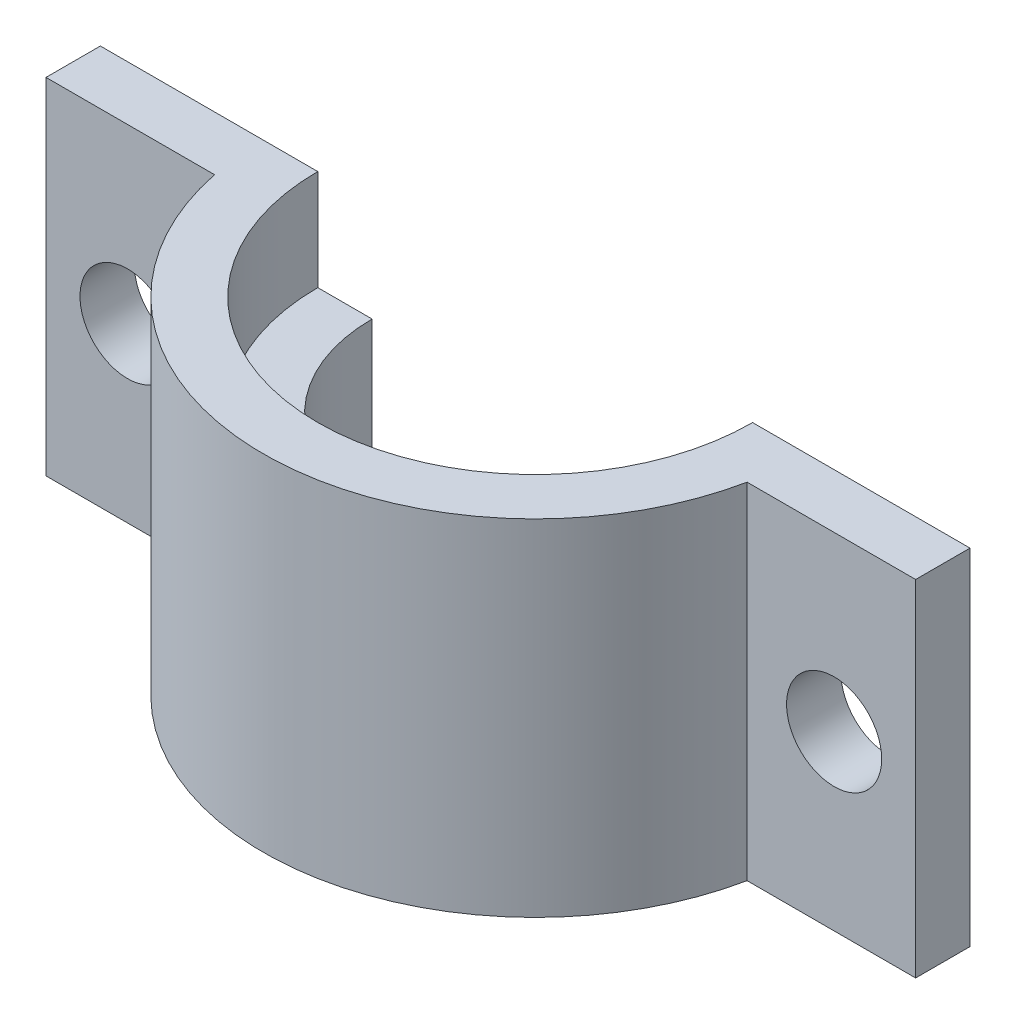
from build123d import *

# Parameters (mm, degrees)
SKETCH1_W           = 32
SKETCH1_H           = 12.7
BOSS_EXTRUDE1_DEPTH = 12
CUT_EXTRUDE1_DEPTH  = 24.691559679
SKETCH5_R           = 1.75
CUT_EXTRUDE2_DEPTH  = 19.98216268


with BuildPart() as part:
    # Sketch1 → Boss-Extrude1 (new body)
    with BuildSketch(Plane.XY):
        Rectangle(SKETCH1_W, SKETCH1_H)
    extrude(amount=BOSS_EXTRUDE1_DEPTH)

    # Sketch3 → Cut-Revolve1 (revolve, cut)
    with BuildSketch(Plane(origin=(0, 0, 0), x_dir=(0, 0, -1), z_dir=(1, 0, 0))):
        Polygon((0, 6.35), (-8, 6.35), (-8, 2.65), (-6, 2.65), (-6, -3.35), (-8, -3.35), (-8, -6.35), (0, -6.35), align=None)
    revolve(axis=Axis((0, 6.35, 0), (0, -1, 0)), mode=Mode.SUBTRACT)

    # Sketch4 → Cut-Extrude1 (cut, through all)
    with BuildSketch(Plane(origin=(0, 6.35, 0), x_dir=(1, 0, 0), z_dir=(0, 1, 0))):
        with BuildLine():
            Line((-16, -2), (-9.797958971, -2))
            ThreePointArc((-9.797958971, -2), (0, -10), (9.797958971, -2))
            Line((9.797958971, -2), (16, -2))
            Line((16, -2), (16, -15))
            Line((16, -15), (-16, -15))
            Line((-16, -15), (-16, -2))
        make_face()
    extrude(amount=-CUT_EXTRUDE1_DEPTH, mode=Mode.SUBTRACT)

    # Sketch5 → Cut-Extrude2 (cut, through all)
    with BuildSketch(Plane.XY.offset(2)):
        with Locations((-13, 0)):
            Circle(SKETCH5_R)
        with Locations((13, 0)):
            Circle(SKETCH5_R)
    extrude(amount=-CUT_EXTRUDE2_DEPTH, mode=Mode.SUBTRACT)


solid = part.part
